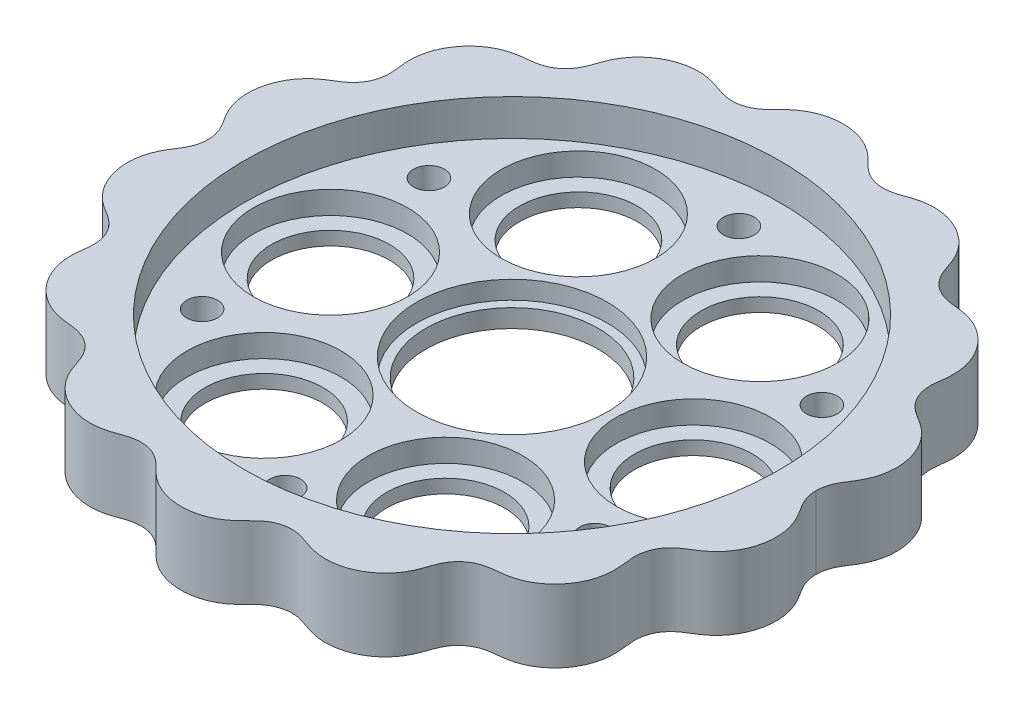
from build123d import *

# Parameters (mm, degrees)
BOSS_EXTRUDE1_START     = -4
BOSS_EXTRUDE1_DEPTH     = 8
CUT_EXTRUDE1_DEPTH      = 52.250027062
CUT_EXTRUDE1_DEPTH_BACK = 52.250027062
SKETCH2_R               = 9.5
SKETCH2_R_2             = 6.5
SKETCH2_3_R             = 8.5
SKETCH2_3_R_2           = 6.5
CUT_EXTRUDE2_DEPTH      = 2.5
SKETCH2_4_R             = 10.5
CUT_EXTRUDE3_DEPTH      = 2
SKETCH3_R               = 29.5
CUT_EXTRUDE4_DEPTH      = 4
M3_CLEARANCE_HOLE1_D    = 3.4
CIRPATTERN1_COUNT       = 6


# Read off the part's stored shape, not the designer's step: Boss-Extrude1
with BuildPart() as part:
    # Boss-Extrude1 outline → Boss-Extrude1 (new body)
    with BuildSketch(Plane(origin=(0, 0, 0), x_dir=(1, 0, 0), z_dir=(0, 1, 0)).offset(BOSS_EXTRUDE1_START)):
        with BuildLine():
            add(Edge.make_bspline(
                [(-33.5, 0), (-33.5, -0.026216999), (-33.500676508, -0.078516883), (-33.503720786, -0.17775582), (-33.511828234, -0.31173155), (-33.526996005, -0.466553375), (-33.553178346, -0.648175674), (-33.595200404, -0.863501485), (-33.658349532, -1.10314746), (-33.755415178, -1.398683736), (-33.889559441, -1.721239842), (-34.066731542, -2.066386483), (-34.33759803, -2.518215594), (-34.671013568, -3.021062626), (-35.03546231, -3.624607433), (-35.370726301, -4.368821862), (-35.609453109, -5.158864299), (-35.744483574, -5.982665392), (-35.772828645, -6.825919268), (-35.693211073, -7.682386348), (-35.501360808, -8.537562558), (-35.193670934, -9.376126546), (-34.767373181, -10.179330804), (-34.246086609, -10.899309491), (-33.644509503, -11.523703616), (-32.981369347, -12.049691614), (-32.281005781, -12.481820472), (-31.557913996, -12.917579235), (-30.885601984, -13.470265954), (-30.320237066, -14.182401451), (-29.929060625, -15.044641799), (-29.765973817, -15.951454589), (-29.796625986, -16.842307921), (-29.919496462, -17.680578946), (-29.994109421, -18.486445579), (-29.970422891, -19.305733752), (-29.839019378, -20.123968135), (-29.598815637, -20.926920201), (-29.253507595, -21.70038835), (-28.811791246, -22.426327046), (-28.280949512, -23.093165852), (-27.668357299, -23.689854991), (-26.98234232, -24.204818907), (-26.246671177, -24.619277383), (-25.475694739, -24.927912635), (-24.684397307, -25.130544122), (-23.889238144, -25.23534295), (-23.053536492, -25.301869109), (-22.188604824, -25.467257846), (-21.344546827, -25.821771625), (-20.587650513, -26.389901962), (-20.016055801, -27.096102653), (-19.624872317, -27.871682111), (-19.361069448, -28.664169016), (-19.103509741, -29.428296904), (-18.7488428, -30.186670563), (-18.282031876, -30.915554812), (-17.698350342, -31.593948744), (-17.004041398, -32.201958542), (-16.2465509, -32.699186502), (-15.445615889, -33.084098119), (-14.617728676, -33.356901965), (-13.778608303, -33.518611569), (-12.939030982, -33.568963908), (-12.114233015, -33.509464815), (-11.317395219, -33.346812438), (-10.559764654, -33.095665291), (-9.887911891, -32.836316973), (-9.267306948, -32.659338385), (-8.584975924, -32.552288483), (-7.83888586, -32.552738679), (-6.979015726, -32.743141837), (-6.126424119, -33.187594876), (-5.429263358, -33.777041859), (-4.842041993, -34.404312843), (-4.25769149, -34.968126103), (-3.597367299, -35.466045575), (-2.865482816, -35.879676417), (-2.071892425, -36.197183166), (-1.23030686, -36.410514225), (-0.360960634, -36.514017215), (0.52151503, -36.504155124), (1.402580135, -36.377943561), (2.265443111, -36.132659599), (3.066444844, -35.780474857), (3.791545139, -35.33364412), (4.43489918, -34.810217959), (4.998051196, -34.235523945), (5.573384318, -33.640780609), (6.249034288, -33.116879541), (6.949050876, -32.777050552), (7.624399022, -32.603954715), (8.337482123, -32.541890188), (9.029133767, -32.596976051), (9.773668183, -32.792127482), (10.559745239, -33.095706545), (11.317406375, -33.34678892), (12.114227112, -33.50947723), (12.9390348, -33.568955885), (13.778605865, -33.518616691), (14.617730145, -33.35689888), (15.445614995, -33.084099997), (16.246551449, -32.699185349), (17.004041059, -32.201959254), (17.698350553, -31.593948301), (18.282031748, -30.91555508), (18.748842876, -30.186670404), (19.103509697, -29.428296997), (19.361069473, -28.664168964), (19.624872304, -27.871682137), (20.016055808, -27.096102638), (20.587650509, -26.389901972), (21.344546829, -25.821771619), (22.188604822, -25.46725785), (23.053536493, -25.301869106), (23.889238143, -25.235342952), (24.684397307, -25.130544121), (25.475694738, -24.927912635), (26.246671177, -24.619277382), (26.98234232, -24.204818907), (27.668357299, -23.689854991), (28.280949512, -23.093165852), (28.811791246, -22.426327046), (29.253507595, -21.70038835), (29.598815637, -20.926920201), (29.839019378, -20.123968135), (29.970422891, -19.305733752), (29.994109421, -18.486445579), (29.919496462, -17.680578946), (29.796625986, -16.842307922), (29.765973818, -15.951454588), (29.929060625, -15.044641801), (30.320237067, -14.182401447), (30.885601984, -13.47026596), (31.557913996, -12.917579226), (32.281005781, -12.48182049), (32.981369347, -12.049691583), (33.644509502, -11.523703669), (34.246086611, -10.899309401), (34.767373178, -10.179330954), (35.193670939, -9.376126304), (35.501360801, -8.537562951), (35.693211085, -7.682385707), (35.772828626, -6.825920319), (35.744483605, -5.982663662), (35.60945306, -5.158866966), (35.370726381, -4.368817521), (35.035462148, -3.624616246), (34.671013847, -3.021047438), (34.337597591, -2.518239495), (34.0667323, -2.066345207), (33.889558103, -1.721312631), (33.755417335, -1.398566328), (33.668053086, -1.132864283), (33.618885538, -0.953154649), (33.58413629, -0.801665223), (33.560165158, -0.679428658), (33.540088712, -0.557083857), (33.523961811, -0.435703148), (33.511828137, -0.311736406), (33.503720817, -0.177726374), (33.500676512, -0.078536656), (33.5, -0.026216999), (33.5, 0)],
                knots=[0.077924489, 0.077924489, 0.077924489, 0.077924489, 0.077924489, 0.078793536, 0.079662583, 0.08053163, 0.081400677, 0.083138771, 0.084876866, 0.08661496, 0.088353054, 0.091829242, 0.094643636, 0.09745803, 0.103086817, 0.108715605, 0.114344392, 0.120231296, 0.126118199, 0.132005103, 0.137892006, 0.144234493, 0.150576979, 0.156919465, 0.163261951, 0.16901636, 0.174770769, 0.180525178, 0.186279587, 0.192629374, 0.198979161, 0.205738622, 0.212498084, 0.218150826, 0.223803567, 0.229456308, 0.235109049, 0.241018837, 0.246928625, 0.252838412, 0.2587482, 0.264732536, 0.270716873, 0.276701209, 0.282685545, 0.288287821, 0.293890097, 0.299492372, 0.305094648, 0.311756408, 0.318418167, 0.32486003, 0.331301892, 0.336941113, 0.342580334, 0.348219556, 0.353858777, 0.360295182, 0.366731587, 0.373167991, 0.379604396, 0.385566533, 0.39152867, 0.397490807, 0.403452943, 0.409029196, 0.414605448, 0.420181701, 0.425757954, 0.429186625, 0.432615297, 0.439472641, 0.446509144, 0.453545648, 0.459217649, 0.46488965, 0.47056165, 0.476233651, 0.482290415, 0.48834718, 0.494403944, 0.500460708, 0.506717837, 0.512974966, 0.519232095, 0.525489224, 0.531115727, 0.536742229, 0.542368732, 0.547995235, 0.554261307, 0.560527379, 0.56395605, 0.567384722, 0.574242066, 0.579818318, 0.585394571, 0.590970824, 0.596547076, 0.602509213, 0.60847135, 0.614433486, 0.620395623, 0.626832028, 0.633268433, 0.639704838, 0.646141243, 0.651780464, 0.657419685, 0.663058906, 0.668698127, 0.67513999, 0.681581852, 0.688243612, 0.694905371, 0.700507647, 0.706109923, 0.711712199, 0.717314474, 0.723298811, 0.729283147, 0.735267483, 0.741251819, 0.747161607, 0.753071395, 0.758981183, 0.76489097, 0.770543711, 0.776196453, 0.781849194, 0.787501935, 0.794261397, 0.801020859, 0.807370646, 0.813720433, 0.819474842, 0.82522925, 0.830983659, 0.836738068, 0.843080554, 0.849423041, 0.855765527, 0.862108013, 0.867994917, 0.87388182, 0.879768724, 0.885655627, 0.891284415, 0.896913202, 0.90254199, 0.905356383, 0.908170777, 0.911646965, 0.91338506, 0.915123154, 0.915992201, 0.916861248, 0.917730295, 0.918599342, 0.919468389, 0.920337437, 0.921206484, 0.922075531, 0.922075531, 0.922075531, 0.922075531, 0.922075531], degree=4))
            add(Edge.make_bspline(
                [(33.5, 0), (33.5, 0.026216999), (33.500676509, 0.078518569), (33.50372079, 0.177636225), (33.511828237, 0.311674182), (33.526995975, 0.46660924), (33.553178416, 0.648159698), (33.595200306, 0.863501283), (33.658349623, 1.10314951), (33.755415083, 1.398682138), (33.889559527, 1.721240899), (34.066731475, 2.066385879), (34.337598093, 2.518215923), (34.671013511, 3.021062435), (35.035462344, 3.624607543), (35.370726286, 4.368821806), (35.609453118, 5.158864334), (35.744483568, 5.982665369), (35.772828649, 6.825919283), (35.69321107, 7.682386338), (35.50136081, 8.537562565), (35.193670932, 9.376126539), (34.767373183, 10.179330812), (34.246086607, 10.899309483), (33.644509507, 11.523703626), (32.981369344, 12.049691606), (32.281005781, 12.481820466), (31.557913997, 12.917579248), (30.885601984, 13.470265945), (30.320237064, 14.182401458), (29.929060631, 15.044641793), (29.765973806, 15.951454597), (29.796626007, 16.84230791), (29.919496442, 17.680578957), (29.994109429, 18.486445574), (29.970422889, 19.305733754), (29.839019379, 20.123968134), (29.598815637, 20.926920201), (29.253507595, 21.70038835), (28.811791246, 22.426327046), (28.280949512, 23.093165852), (27.668357299, 23.689854991), (26.98234232, 24.204818907), (26.246671177, 24.619277384), (25.47569474, 24.927912633), (24.684397304, 25.130544131), (23.88923815, 25.235342928), (23.053536485, 25.301869131), (22.18860483, 25.467257833), (21.344546821, 25.821771631), (20.587650521, 26.389901958), (20.01605579, 27.096102656), (19.624872331, 27.87168211), (19.361069436, 28.664169017), (19.103509747, 29.428296904), (18.748842783, 30.186670563), (18.282031917, 30.915554813), (17.698350267, 31.593948741), (17.004041524, 32.201958546), (16.246550693, 32.699186495), (15.44561623, 33.084098131), (14.617728116, 33.356901945), (13.778609236, 33.518611602), (12.939029518, 33.568963857), (12.114235287, 33.509464894), (11.317390885, 33.346812298), (10.55977243, 33.095665511), (9.887900123, 32.836316749), (9.267320451, 32.6593381), (8.706237056, 32.57131778), (8.215146041, 32.552498079), (7.624379241, 32.603984554), (6.949064821, 32.77702953), (6.249024969, 33.116893571), (5.573390361, 33.640771534), (4.998047425, 34.23552959), (4.43490147, 34.810214547), (3.791543723, 35.333646174), (3.06644575, 35.78047365), (2.2654425, 36.132660246), (1.402580594, 36.37794332), (0.521514606, 36.504155024), (-0.360960137, 36.514017681), (-1.230307555, 36.410513277), (-2.071891361, 36.197184826), (-2.865484417, 35.879673792), (-3.59736483, 35.466049685), (-4.257696094, 34.968118398), (-4.842034252, 34.404325812), (-5.429275888, 33.777020825), (-6.126406081, 33.187625198), (-6.9790442, 32.743093944), (-7.959870147, 32.526018012), (-8.909996394, 32.565833875), (-9.773705477, 32.792081747), (-10.559723503, 33.095734538), (-11.317419057, 33.346772326), (-12.114220372, 33.50948609), (-12.939039168, 33.568950135), (-13.778603073, 33.518620368), (-14.617731827, 33.356896665), (-15.445613969, 33.084101347), (-16.246552081, 32.69918452), (-17.004040667, 32.201959765), (-17.6983508, 31.593947983), (-18.282031594, 30.915555272), (-18.748842974, 30.18667029), (-19.103509636, 29.428297062), (-19.361069498, 28.664168928), (-19.6248723, 27.871682154), (-20.016055808, 27.09610263), (-20.587650509, 26.389901974), (-21.344546828, 25.821771621), (-22.188604825, 25.46725784), (-23.053536488, 25.301869126), (-23.889238148, 25.235342931), (-24.684397305, 25.130544129), (-25.475694739, 24.927912633), (-26.246671177, 24.619277383), (-26.98234232, 24.204818907), (-27.668357299, 23.689854991), (-28.280949511, 23.093165852), (-28.811791246, 22.426327046), (-29.253507595, 21.70038835), (-29.598815637, 20.926920201), (-29.839019379, 20.123968134), (-29.970422889, 19.305733754), (-29.994109429, 18.486445574), (-29.919496442, 17.680578956), (-29.796626007, 16.842307911), (-29.765973806, 15.951454596), (-29.929060631, 15.044641795), (-30.320237064, 14.182401454), (-30.885601984, 13.47026595), (-31.557913997, 12.917579239), (-32.281005781, 12.481820484), (-32.981369344, 12.049691575), (-33.644509506, 11.523703679), (-34.246086608, 10.899309394), (-34.767373181, 10.179330959), (-35.193670937, 9.3761263), (-35.501360803, 8.537562954), (-35.693211082, 7.682385704), (-35.77282863, 6.825920322), (-35.744483599, 5.982663659), (-35.60945307, 5.158866969), (-35.370726364, 4.368817517), (-35.035462184, 3.624616252), (-34.671013786, 3.021047426), (-34.33759766, 2.518239543), (-34.066732221, 2.066345083), (-33.889558211, 1.721312861), (-33.755417207, 1.398566007), (-33.668053204, 1.132864324), (-33.618885449, 0.953157317), (-33.584136315, 0.801658282), (-33.560165169, 0.679422844), (-33.540088707, 0.557106056), (-33.523961806, 0.435734261), (-33.511828138, 0.311679462), (-33.503720818, 0.17760792), (-33.500676512, 0.078538627), (-33.5, 0.026216999), (-33.5, 0)],
                knots=[0.077924489, 0.077924489, 0.077924489, 0.077924489, 0.077924489, 0.078793536, 0.079662583, 0.08053163, 0.081400677, 0.083138771, 0.084876866, 0.08661496, 0.088353054, 0.091829242, 0.094643636, 0.09745803, 0.103086817, 0.108715605, 0.114344392, 0.120231296, 0.126118199, 0.132005103, 0.137892006, 0.144234493, 0.150576979, 0.156919465, 0.163261951, 0.16901636, 0.174770769, 0.180525178, 0.186279587, 0.192629374, 0.198979161, 0.205738622, 0.212498084, 0.218150826, 0.223803567, 0.229456308, 0.235109049, 0.241018837, 0.246928625, 0.252838412, 0.2587482, 0.264732536, 0.270716873, 0.276701209, 0.282685545, 0.288287821, 0.293890097, 0.299492372, 0.305094648, 0.311756408, 0.318418167, 0.32486003, 0.331301892, 0.336941113, 0.342580334, 0.348219556, 0.353858777, 0.360295182, 0.366731587, 0.373167991, 0.379604396, 0.385566533, 0.39152867, 0.397490807, 0.403452943, 0.409029196, 0.414605448, 0.420181701, 0.425757954, 0.429186625, 0.432615297, 0.436043969, 0.439472641, 0.445738713, 0.452004785, 0.457631287, 0.46325779, 0.468884293, 0.474510796, 0.480767924, 0.487025053, 0.493282182, 0.499539311, 0.505596076, 0.51165284, 0.517709604, 0.523766368, 0.529438369, 0.53511037, 0.540782371, 0.546454371, 0.553490875, 0.560527379, 0.567384722, 0.574242066, 0.579818318, 0.585394571, 0.590970824, 0.596547076, 0.602509213, 0.60847135, 0.614433486, 0.620395623, 0.626832028, 0.633268433, 0.639704838, 0.646141243, 0.651780464, 0.657419685, 0.663058906, 0.668698127, 0.67513999, 0.681581852, 0.688243612, 0.694905371, 0.700507647, 0.706109923, 0.711712199, 0.717314474, 0.723298811, 0.729283147, 0.735267483, 0.741251819, 0.747161607, 0.753071395, 0.758981183, 0.76489097, 0.770543711, 0.776196453, 0.781849194, 0.787501935, 0.794261397, 0.801020859, 0.807370646, 0.813720433, 0.819474842, 0.82522925, 0.830983659, 0.836738068, 0.843080554, 0.849423041, 0.855765527, 0.862108013, 0.867994917, 0.87388182, 0.879768724, 0.885655627, 0.891284415, 0.896913202, 0.90254199, 0.905356383, 0.908170777, 0.911646965, 0.91338506, 0.915123154, 0.915992201, 0.916861248, 0.917730295, 0.918599342, 0.919468389, 0.920337437, 0.921206484, 0.922075531, 0.922075531, 0.922075531, 0.922075531, 0.922075531], degree=4))
        make_face()
    extrude(amount=BOSS_EXTRUDE1_DEPTH)

    # Sketch2 → Cut-Extrude1 (cut, two sides: drawn at the far end of the back side and taken through both)
    with BuildSketch(Plane(origin=(0, 0, 0), x_dir=(1, 0, 0), z_dir=(0, 1, 0)).offset(-CUT_EXTRUDE1_DEPTH_BACK)):
        with Locations(Location((0, 0, 0), (0, 0, 270))):
            Circle(SKETCH2_R)
        with Locations(Location((-20, 0, 0), (0, 0, 270))):
            Circle(SKETCH2_R_2)
        with Locations(Location((-10, 17.320508076, 0), (0, 0, 270))):
            Circle(SKETCH2_R_2)
        with Locations(Location((10, 17.320508076, 0), (0, 0, 270))):
            Circle(SKETCH2_R_2)
        with Locations(Location((20, 0, 0), (0, 0, 270))):
            Circle(SKETCH2_R_2)
        with Locations(Location((10, -17.320508076, 0), (0, 0, 270))):
            Circle(SKETCH2_R_2)
        with Locations(Location((-10, -17.320508076, 0), (0, 0, 270))):
            Circle(SKETCH2_R_2)
    extrude(amount=CUT_EXTRUDE1_DEPTH + CUT_EXTRUDE1_DEPTH_BACK, mode=Mode.SUBTRACT)

    # Sketch2<3> → Cut-Extrude2 (cut, symmetric)
    # profile 1 of 6: a face of its own
    with BuildSketch(Plane(origin=(0, 0, 0), x_dir=(1, 0, 0), z_dir=(0, 1, 0))):
        with Locations(Location((-20, 0, 0), (0, 0, 270))):
            Circle(SKETCH2_3_R)
        with Locations(Location((-20, 0, 0), (0, 0, 270))):
            Circle(SKETCH2_3_R_2, mode=Mode.SUBTRACT)
    # profile 2 of 6: a face of its own
    with BuildSketch(Plane(origin=(0, 0, 0), x_dir=(1, 0, 0), z_dir=(0, 1, 0))):
        with Locations(Location((-10, 17.320508076, 0), (0, 0, 270))):
            Circle(SKETCH2_3_R)
        with Locations(Location((-10, 17.320508076, 0), (0, 0, 270))):
            Circle(SKETCH2_3_R_2, mode=Mode.SUBTRACT)
    # profile 3 of 6: a face of its own
    with BuildSketch(Plane(origin=(0, 0, 0), x_dir=(1, 0, 0), z_dir=(0, 1, 0))):
        with Locations(Location((10, 17.320508076, 0), (0, 0, 270))):
            Circle(SKETCH2_3_R)
        with Locations(Location((10, 17.320508076, 0), (0, 0, 270))):
            Circle(SKETCH2_3_R_2, mode=Mode.SUBTRACT)
    # profile 4 of 6: a face of its own
    with BuildSketch(Plane(origin=(0, 0, 0), x_dir=(1, 0, 0), z_dir=(0, 1, 0))):
        with Locations(Location((20, 0, 0), (0, 0, 270))):
            Circle(SKETCH2_3_R)
        with Locations(Location((20, 0, 0), (0, 0, 270))):
            Circle(SKETCH2_3_R_2, mode=Mode.SUBTRACT)
    # profile 5 of 6: a face of its own
    with BuildSketch(Plane(origin=(0, 0, 0), x_dir=(1, 0, 0), z_dir=(0, 1, 0))):
        with Locations(Location((10, -17.320508076, 0), (0, 0, 270))):
            Circle(SKETCH2_3_R)
        with Locations(Location((10, -17.320508076, 0), (0, 0, 270))):
            Circle(SKETCH2_3_R_2, mode=Mode.SUBTRACT)
    # profile 6 of 6: a face of its own
    with BuildSketch(Plane(origin=(0, 0, 0), x_dir=(1, 0, 0), z_dir=(0, 1, 0))):
        with Locations(Location((-10, -17.320508076, 0), (0, 0, 270))):
            Circle(SKETCH2_3_R)
        with Locations(Location((-10, -17.320508076, 0), (0, 0, 270))):
            Circle(SKETCH2_3_R_2, mode=Mode.SUBTRACT)
    extrude(amount=CUT_EXTRUDE2_DEPTH, both=True, mode=Mode.SUBTRACT)

    # Sketch2<4> → Cut-Extrude3 (cut, symmetric)
    with BuildSketch(Plane(origin=(0, 0, 0), x_dir=(1, 0, 0), z_dir=(0, 1, 0))):
        with Locations(Location((0, 0, 0), (0, 0, 270))):
            Circle(SKETCH2_4_R)
    extrude(amount=CUT_EXTRUDE3_DEPTH, both=True, mode=Mode.SUBTRACT)

    # Sketch3 → Cut-Extrude4 (cut)
    with BuildSketch(Plane(origin=(0, 4, 0), x_dir=(1, 0, 0), z_dir=(0, 1, 0))):
        with Locations(Location((0, 0, 0), (0, 0, 270))):
            Circle(SKETCH3_R)
    extrude(amount=-CUT_EXTRUDE4_DEPTH, mode=Mode.SUBTRACT)

    # M3 Clearance Hole1 (through all)
    with Locations(Plane(origin=(0, 0, 0), x_dir=(1, 0, 0), z_dir=(0, 1, 0))):
        with Locations((0, 25)):
            m3_clearance_hole1 = Hole(M3_CLEARANCE_HOLE1_D / 2)

    # CirPattern1: M3 Clearance Hole1 ×6 about axis
    cirpattern1_axis = Axis((0, 0, 0), (0, 1, 0))
    for i in range(1, CIRPATTERN1_COUNT):
        add(m3_clearance_hole1.rotate(cirpattern1_axis, i * 360 / CIRPATTERN1_COUNT), mode=Mode.SUBTRACT)


solid = part.part
